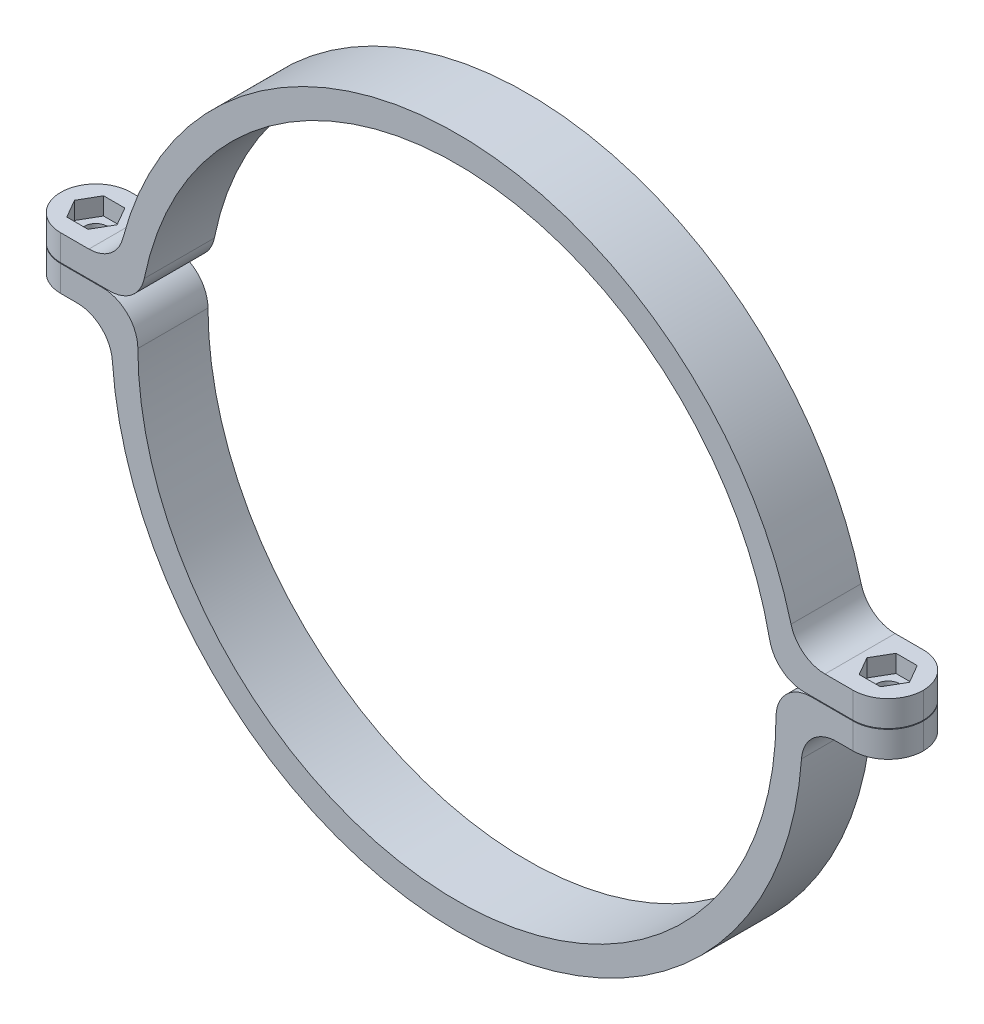
from build123d import *

# Parameters (mm, degrees)
BOSS_EXTRUDE1_DEPTH     = 20
CUT_EXTRUDE1_DEPTH      = 272.678972695
CUT_EXTRUDE1_DEPTH_BACK = 272.678972695
SKETCH3_W               = 20
SKETCH3_H               = 0.2
FILLET1_R               = 10
FILLET2_R               = 10
FILLET3_R               = 10
FILLET4_R               = 10
CUT_EXTRUDE2_DEPTH      = 5
SKETCH5_R               = 3.25
CUT_EXTRUDE3_DEPTH      = 177.203869452


with BuildPart() as part:
    # Sketch2 → Boss-Extrude1 (new body)
    with BuildSketch(Plane(origin=(0, 0, 40), x_dir=(-1, 0, 0), z_dir=(0, 0, -1))):
        with BuildLine():
            Line((97.991071022, 10), (122.991071022, 10))
            Line((122.991071022, 10), (122.991071022, 17.5))
            Line((122.991071022, 17.5), (96.932966528, 17.5))
            ThreePointArc((96.932966528, 17.5), (97.534135582, 13.760174282), (97.991071022, 10))
        make_face()
        with BuildLine():
            Line((90.44888059, 10), (97.991071022, 10))
            ThreePointArc((97.991071022, 10), (97.534135582, 13.760174282), (96.932966528, 17.5))
            Line((96.932966528, 17.5), (89.301455755, 17.5))
            ThreePointArc((89.301455755, 17.5), (89.953367664, 13.761963738), (90.44888059, 10))
        make_face()
        with BuildLine():
            Line((89.301455755, 17.5), (96.932966528, 17.5))
            ThreePointArc((96.932966528, 17.5), (0, 98.5), (-96.932966528, 17.5))
            Line((-96.932966528, 17.5), (-89.301455755, 17.5))
            ThreePointArc((-89.301455755, 17.5), (0, 91), (89.301455755, 17.5))
        make_face()
        with BuildLine():
            Line((90.965652859, 2.5), (98.468269001, 2.5))
            ThreePointArc((98.468269001, 2.5), (98.301223647, 6.2545527), (97.991071022, 10))
            Line((97.991071022, 10), (90.44888059, 10))
            ThreePointArc((90.44888059, 10), (90.784749472, 6.255338791), (90.965652859, 2.5))
        make_face()
        with BuildLine():
            Line((98.468269001, 2.5), (122.991071022, 2.5))
            Line((122.991071022, 2.5), (122.991071022, 10))
            Line((122.991071022, 10), (97.991071022, 10))
            ThreePointArc((97.991071022, 10), (98.301223647, 6.2545527), (98.468269001, 2.5))
        make_face()
        with BuildLine():
            ThreePointArc((98.5, 0), (98.492066931, 1.250100682), (98.468269001, 2.5))
            Line((98.468269001, 2.5), (90.965652859, 2.5))
            ThreePointArc((90.965652859, 2.5), (90.991412809, 1.250117967), (91, 0))
            ThreePointArc((91, 0), (-1.250117967, -90.991412809), (-90.965652859, 2.5))
            Line((-90.965652859, 2.5), (-98.468269001, 2.5))
            ThreePointArc((-98.468269001, 2.5), (-1.250100682, -98.492066931), (98.5, 0))
        make_face()
        with BuildLine():
            Line((-98.468269001, 2.5), (-90.965652859, 2.5))
            ThreePointArc((-90.965652859, 2.5), (-90.784749472, 6.255338791), (-90.44888059, 10))
            Line((-90.44888059, 10), (-97.991071022, 10))
            ThreePointArc((-97.991071022, 10), (-98.301223647, 6.2545527), (-98.468269001, 2.5))
        make_face()
        with BuildLine():
            Line((-97.991071022, 10), (-90.44888059, 10))
            ThreePointArc((-90.44888059, 10), (-89.953367664, 13.761963738), (-89.301455755, 17.5))
            Line((-89.301455755, 17.5), (-96.932966528, 17.5))
            ThreePointArc((-96.932966528, 17.5), (-97.534135582, 13.760174282), (-97.991071022, 10))
        make_face()
        with BuildLine():
            Line((-122.991071022, 10), (-97.991071022, 10))
            ThreePointArc((-97.991071022, 10), (-97.534135582, 13.760174282), (-96.932966528, 17.5))
            Line((-96.932966528, 17.5), (-122.991071022, 17.5))
            Line((-122.991071022, 17.5), (-122.991071022, 10))
        make_face()
        with BuildLine():
            Line((-122.991071022, 2.5), (-98.468269001, 2.5))
            ThreePointArc((-98.468269001, 2.5), (-98.301223647, 6.2545527), (-97.991071022, 10))
            Line((-97.991071022, 10), (-122.991071022, 10))
            Line((-122.991071022, 10), (-122.991071022, 2.5))
        make_face()
    extrude(amount=-BOSS_EXTRUDE1_DEPTH)

    # Sketch3 → Cut-Extrude1 (cut, two sides: drawn at the far end of the back side and taken through both)
    with BuildSketch(Plane(origin=(122.991071022, 0, 0), x_dir=(0, 0, -1), z_dir=(1, 0, 0)).offset(-CUT_EXTRUDE1_DEPTH_BACK)):
        with Locations((-50, 10)):
            Rectangle(SKETCH3_W, SKETCH3_H)
    extrude(amount=CUT_EXTRUDE1_DEPTH + CUT_EXTRUDE1_DEPTH_BACK, mode=Mode.SUBTRACT)


with BuildPart() as cut_extrude1_piece_1:
    # of the separate pieces the step leaves, piece 1, a body of its own (cut_extrude1_pieces)
    add(part.part.solids().sort_by_distance((-122.991071022, 2.5, 40))[0])

    # Fillet2
    fillet2_edges = [cut_extrude1_piece_1.edges().sort_by_distance(p)[0] for p in [
        (-98.468269001, 2.5, 50),
        (98.468269001, 2.5, 50),
        (90.45988061, 9.9, 50),
        (-90.45988061, 9.9, 50),
    ]]
    fillet(fillet2_edges, radius=FILLET2_R)

    # Fillet3
    fillet3_edges = [cut_extrude1_piece_1.edges().sort_by_distance(p)[0] for p in [
        (122.991071022, 6.2, 60),
        (-122.991071022, 6.2, 40),
        (-122.991071022, 6.2, 60),
        (122.991071022, 6.2, 40),
    ]]
    fillet(fillet3_edges, radius=FILLET3_R - 0.0001)  # a hair under: the kernel refuses the full size


with BuildPart() as cut_extrude1_piece_2:
    # of the separate pieces the step leaves, piece 2, a body of its own (cut_extrude1_pieces)
    add(part.part.solids().sort_by_distance((-122.991071022, 10.1, 40))[0])

    # Fillet1
    fillet1_edges = [cut_extrude1_piece_2.edges().sort_by_distance(p)[0] for p in [
        (96.932966528, 17.5, 50),
        (-96.932966528, 17.5, 50),
        (90.437768659, 10.1, 50),
        (-90.437768659, 10.1, 50),
    ]]
    fillet(fillet1_edges, radius=FILLET1_R)

    # Fillet4
    fillet4_edges = [cut_extrude1_piece_2.edges().sort_by_distance(p)[0] for p in [
        (-122.991071022, 13.8, 60),
        (-122.991071022, 13.8, 40),
        (122.991071022, 13.8, 60),
        (122.991071022, 13.8, 40),
    ]]
    fillet(fillet4_edges, radius=FILLET4_R - 0.0001)  # a hair under: the kernel refuses the full size

    # Sketch4 → Cut-Extrude2 (cut)
    with BuildSketch(Plane(origin=(0, 17.5, 0), x_dir=(1, 0, 0), z_dir=(0, 1, 0))):
        Polygon((109.959982109, -55.25), (116.022159935, -55.25), (119.053248848, -50), (116.022159935, -44.75), (109.959982109, -44.75), (106.928893195, -50), align=None)
        Polygon((-106.928893195, -50), (-109.959982109, -44.75), (-116.022159935, -44.75), (-119.053248848, -50), (-116.022159935, -55.25), (-109.959982109, -55.25), align=None)
    extrude(amount=-CUT_EXTRUDE2_DEPTH, mode=Mode.SUBTRACT)


with BuildPart() as cut_extrude3_tool:
    # Sketch5 → Cut-Extrude3 (new, through all)
    with BuildSketch(Plane(origin=(0, 12.5, 0), x_dir=(1, 0, 0), z_dir=(0, 1, 0))):
        with Locations(Location((-112.991071022, -50, 0), (0, 0, 270))):
            Circle(SKETCH5_R)
        with Locations(Location((112.991071022, -50, 0), (0, 0, 270))):
            Circle(SKETCH5_R)
    extrude(amount=-CUT_EXTRUDE3_DEPTH)


with BuildPart() as cut_extrude1_piece_1_1:
    add(cut_extrude1_piece_1.part)

    # Cut-Extrude3: cut by cut_extrude3_tool
    add(cut_extrude3_tool.part, mode=Mode.SUBTRACT)


with BuildPart() as cut_extrude1_piece_2_1:
    add(cut_extrude1_piece_2.part)

    # Cut-Extrude3: cut by cut_extrude3_tool
    add(cut_extrude3_tool.part, mode=Mode.SUBTRACT)


solid = Compound([cut_extrude1_piece_1_1.part, cut_extrude1_piece_2_1.part])
